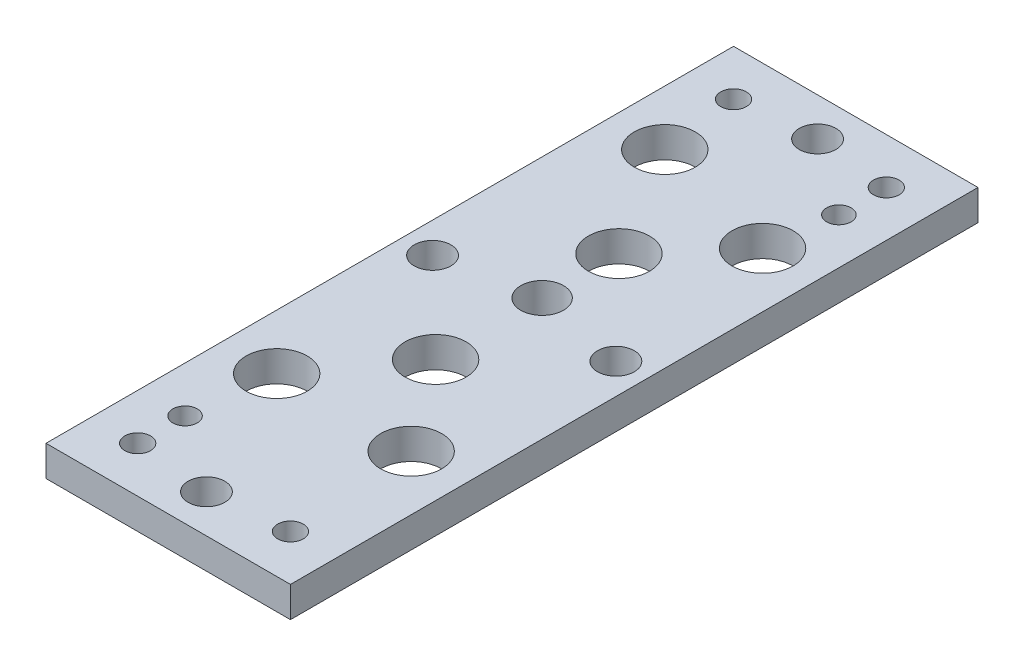
from build123d import *

# Parameters (mm, degrees)
SKETCH1_W             = 80
SKETCH1_H             = 225
BOSS_EXTRUDE1_DEPTH   = 10
CUT_EXTRUDE1_REACH    = 121.818
SKETCH2_R             = 6
M8_CLEARANCE_HOLE1_D  = 8.4
F_8_0MM_DOWEL_HOLE1_D = 8
CUT_EXTRUDE3_REACH    = 121.818
SKETCH10_R            = 7
SKETCH14_R            = 10
CUT_EXTRUDE4_DEPTH    = 120.817569663


with BuildPart() as part:
    # Sketch1 → Boss-Extrude1 (new body)
    with BuildSketch(Plane(origin=(0, 0, 0), x_dir=(1, 0, 0), z_dir=(0, 1, 0))):
        Rectangle(SKETCH1_W, SKETCH1_H)
    extrude(amount=-BOSS_EXTRUDE1_DEPTH)

    # Sketch2 → Cut-Extrude1 (cut, up to next)
    with BuildSketch(Plane(origin=(0, 0, 0), x_dir=(1, 0, 0), z_dir=(0, 1, 0)), mode=Mode.PRIVATE) as cut_extrude1_sk1:
        with Locations((0, 100)):
            Circle(SKETCH2_R)
    cut_extrude1_tool1 = extrude(cut_extrude1_sk1.sketch, amount=-CUT_EXTRUDE1_REACH, mode=Mode.PRIVATE) & part.part
    # Sketch2 → Cut-Extrude1 (cut, up to next)
    with BuildSketch(Plane(origin=(0, 0, 0), x_dir=(1, 0, 0), z_dir=(0, 1, 0)), mode=Mode.PRIVATE) as cut_extrude1_sk2:
        with Locations((30, 4)):
            Circle(SKETCH2_R)
    cut_extrude1_tool2 = extrude(cut_extrude1_sk2.sketch, amount=-CUT_EXTRUDE1_REACH, mode=Mode.PRIVATE) & part.part
    # Sketch2 → Cut-Extrude1 (cut, up to next)
    with BuildSketch(Plane(origin=(0, 0, 0), x_dir=(1, 0, 0), z_dir=(0, 1, 0)), mode=Mode.PRIVATE) as cut_extrude1_sk3:
        with Locations((-30, 4)):
            Circle(SKETCH2_R)
    cut_extrude1_tool3 = extrude(cut_extrude1_sk3.sketch, amount=-CUT_EXTRUDE1_REACH, mode=Mode.PRIVATE) & part.part
    # Sketch2 → Cut-Extrude1 (cut, up to next)
    with BuildSketch(Plane(origin=(0, 0, 0), x_dir=(1, 0, 0), z_dir=(0, 1, 0)), mode=Mode.PRIVATE) as cut_extrude1_sk4:
        with Locations((0, -100)):
            Circle(SKETCH2_R)
    cut_extrude1_tool4 = extrude(cut_extrude1_sk4.sketch, amount=-CUT_EXTRUDE1_REACH, mode=Mode.PRIVATE) & part.part
    add(cut_extrude1_tool1.solids().sort_by_distance((0, 0, -100))[0], mode=Mode.SUBTRACT)
    add(cut_extrude1_tool2.solids().sort_by_distance((30, 0, -4))[0], mode=Mode.SUBTRACT)
    add(cut_extrude1_tool3.solids().sort_by_distance((-30, 0, -4))[0], mode=Mode.SUBTRACT)
    add(cut_extrude1_tool4.solids().sort_by_distance((0, 0, 100))[0], mode=Mode.SUBTRACT)

    # M8 Clearance Hole1 (through all)
    with Locations(Plane(origin=(0, 0, 0), x_dir=(1, 0, 0), z_dir=(0, 1, 0))):
        with Locations((-25, 97.5), (25, 97.5), (25, -97.5), (-25, -97.5)):
            Hole(M8_CLEARANCE_HOLE1_D / 2)

    # Ø8.0mm Dowel Hole1 (through all)
    with Locations(Plane(origin=(0, 0, 0), x_dir=(1, 0, 0), z_dir=(0, 1, 0))):
        with Locations((25, 81.975), (-25, -82)):
            Hole(F_8_0MM_DOWEL_HOLE1_D / 2)

    # Sketch10 → Cut-Extrude3 (cut, up to next)
    with BuildSketch(Plane(origin=(0, 0, 0), x_dir=(1, 0, 0), z_dir=(0, 1, 0)), mode=Mode.PRIVATE) as cut_extrude3_sk1:
        with Locations((0, 9.86)):
            Circle(SKETCH10_R)
    cut_extrude3_tool1 = extrude(cut_extrude3_sk1.sketch, amount=-CUT_EXTRUDE3_REACH, mode=Mode.PRIVATE) & part.part
    add(cut_extrude3_tool1.solids().sort_by_distance((0, 0, -9.86))[0], mode=Mode.SUBTRACT)

    # Sketch14 → Cut-Extrude4 (cut, through all)
    with BuildSketch(Plane(origin=(0, -10, 0), x_dir=(1, 0, 0), z_dir=(0, 1, 0))):
        with Locations((22, 60)):
            Circle(SKETCH14_R)
        with Locations((-22, 72)):
            Circle(SKETCH14_R)
        with Locations((0, 35)):
            Circle(SKETCH14_R)
        with Locations((0, -25)):
            Circle(SKETCH14_R)
        with Locations((-22, -55)):
            Circle(SKETCH14_R)
        with Locations((22, -55)):
            Circle(SKETCH14_R)
    extrude(amount=CUT_EXTRUDE4_DEPTH, mode=Mode.SUBTRACT)


solid = part.part
